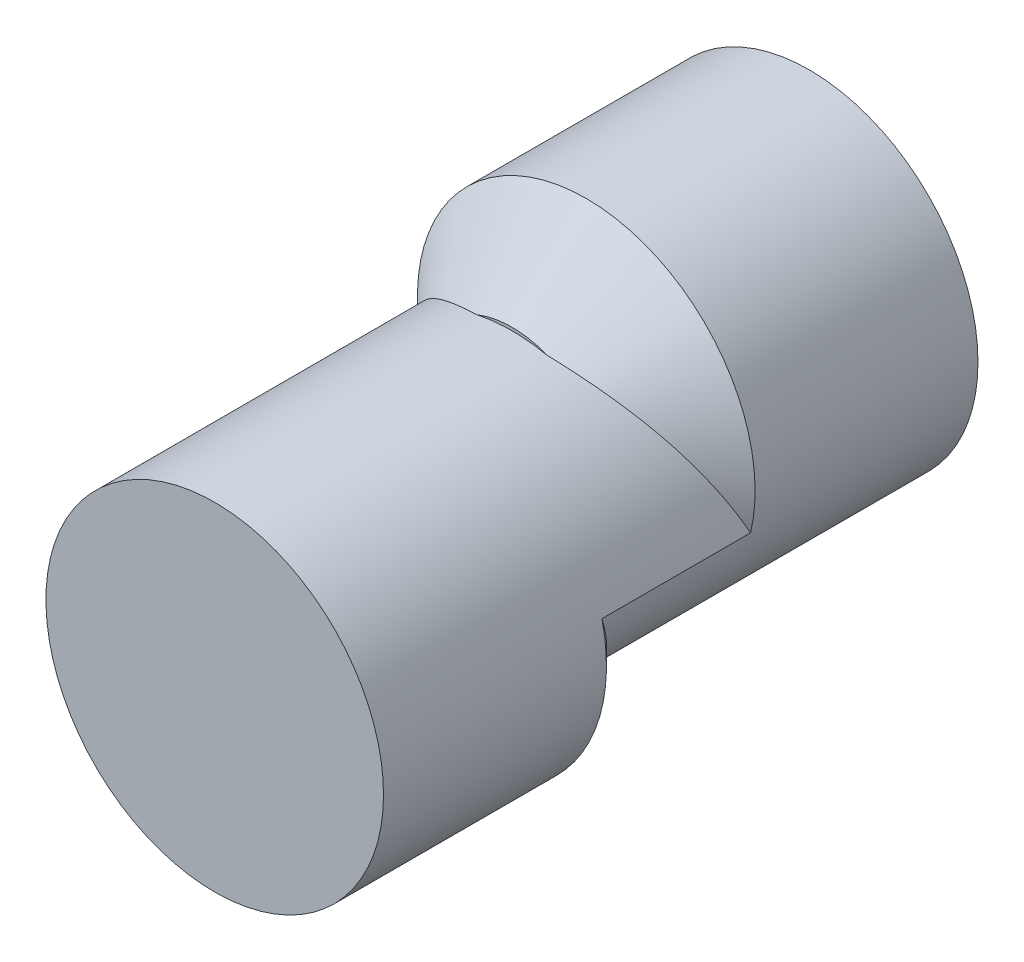
from build123d import *

# Parameters (mm, degrees)
ESQUISSE1_R             = 3.975
BOSS_EXTRU_1_DEPTH      = 7
ESQUISSE2_R             = 3.975
BOSS_EXTRU_2_DEPTH      = 7
ENL_V_START             = -2
ENL_V_MAT_EXTRU_1_DEPTH = 14.38022269
CHANFREIN2_SIZE         = 1.75
CHANFREIN4_SIZE         = 1.75


with BuildPart() as part:
    # Esquisse1 → Boss.-Extru.1 (new body)
    with BuildSketch(Plane.XY):
        with Locations((0, 0.822072072)):
            Circle(ESQUISSE1_R)
    extrude(amount=BOSS_EXTRU_1_DEPTH)

    # Esquisse2 → Boss.-Extru.2 (add)
    with BuildSketch(Plane.XY.offset(7)):
        with Locations(Location((0, -1, 0), (0, 0, 166.750525957))):
            Circle(ESQUISSE2_R)
    extrude(amount=BOSS_EXTRU_2_DEPTH)

    # Esquisse3 → Enlèv. mat.-Extru.1 (cut, through all)
    with BuildSketch(Plane.XY.offset(14).offset(ENL_V_START)):
        with BuildLine():
            Line((-1.532970972, 2.1), (1.532970972, 2.1))
            ThreePointArc((1.532970972, 2.1), (0, -2.6), (-1.532970972, 2.1))
        make_face()
    extrude(amount=-ENL_V_MAT_EXTRU_1_DEPTH, mode=Mode.SUBTRACT)

    # Chanfrein2
    # the kernel refuses this chamfer: 1.75 mm, written as the material it takes off along each edge
    with BuildSketch(Plane(origin=(0, 0.822072072, 7), x_dir=(1, 0, 0), z_dir=(0, -1, 0))) as chanfrein2_piece_1_section:
        Polygon((3.975, -CHANFREIN2_SIZE), (3.975 - CHANFREIN2_SIZE, 0), (3.975, 0), align=None)
    chanfrein2_piece_1 = revolve(axis=Axis((0, 0.822072072, 7), (0, 0, 1)), revolution_arc=258.239304613, mode=Mode.PRIVATE)
    chanfrein2_piece_1 = chanfrein2_piece_1 - Plane(origin=(0, -1, 6.142541617), x_dir=(-0.9733813624059963, 0.22919145560130838, 0), z_dir=(0, 0, -1)) * Cylinder(3.975, 16, mode=Mode.PRIVATE)
    add(chanfrein2_piece_1, mode=Mode.SUBTRACT)
    with BuildSketch(Plane(origin=(0, 0.822072072, 7), x_dir=(0.20586939253859726, -0.9785794772095873, 0), z_dir=(-0.9785794772095873, -0.20586939253859726, 0))) as chanfrein2_piece_2_section:
        Polygon((3.975, -CHANFREIN2_SIZE), (3.975 - CHANFREIN2_SIZE, 0), (3.975, 0), align=None)
    chanfrein2_piece_2 = revolve(axis=Axis((0, 0.822072072, 7), (0, 0, 1)), revolution_arc=78.119602811, mode=Mode.PRIVATE)
    chanfrein2_piece_2 = chanfrein2_piece_2 - Plane(origin=(0, -1, 6.194476716), x_dir=(-0.9733813624059963, 0.22919145560130838, 0), z_dir=(0, 0, -1)) * Cylinder(3.975, 16, mode=Mode.PRIVATE)
    add(chanfrein2_piece_2, mode=Mode.SUBTRACT)

    # Chanfrein4
    # the kernel refuses this chamfer: 1.75 mm, written as the material it takes off along each edge
    with BuildSketch(Plane(origin=(0, -1, 7), x_dir=(-0.2035326199648153, 0.9790681654564498, 0), z_dir=(0.9790681654564498, 0.2035326199648153, 0))) as chanfrein4_piece_1_section:
        Polygon((3.975 - CHANFREIN4_SIZE, 0), (3.975, CHANFREIN4_SIZE), (3.975, 0), align=None)
    chanfrein4_piece_1 = revolve(axis=Axis((0, -1, 7), (0, 0, 1)), revolution_arc=336.512773019, mode=Mode.PRIVATE)
    chanfrein4_piece_1 = chanfrein4_piece_1 - Plane(origin=(0, 0.822072072, 7.857337324), x_dir=(1, 0, 0), z_dir=(0, 0, -1)) * Cylinder(3.975, 16, mode=Mode.PRIVATE)
    add(chanfrein4_piece_1, mode=Mode.SUBTRACT)


solid = part.part
